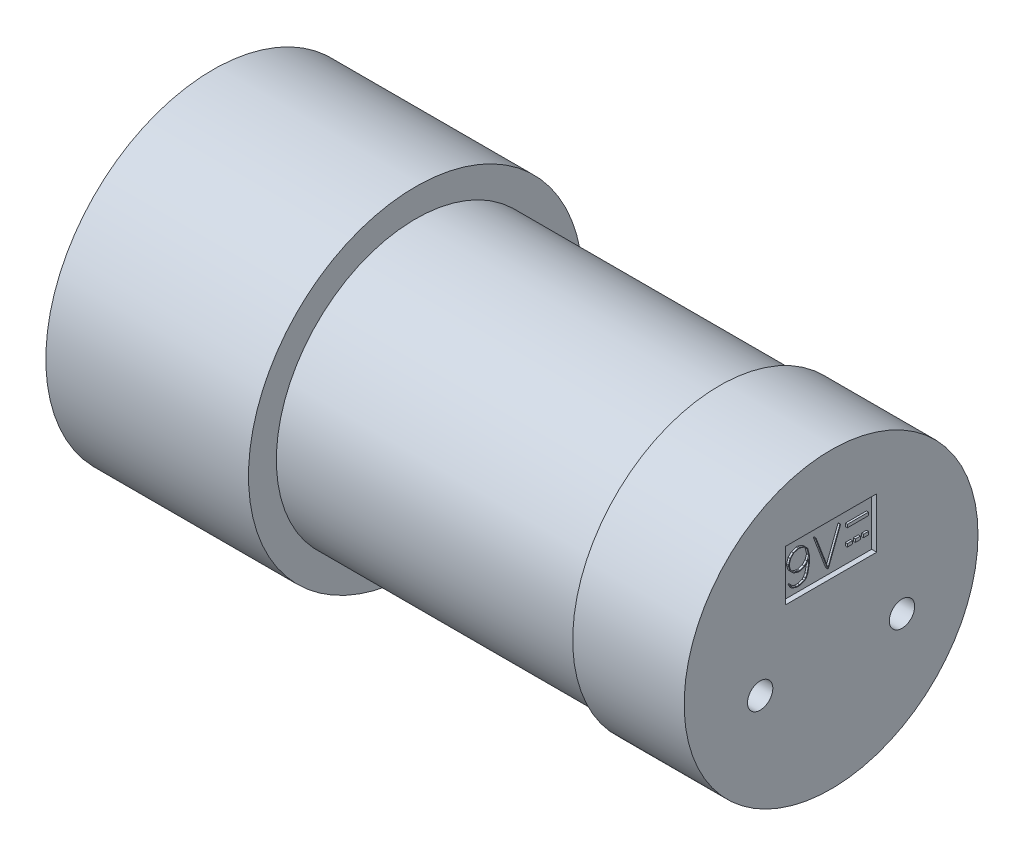
from build123d import *

# Parameters (mm, degrees)
SKETCH_1_R                   = 16.5
EXTRUDE_1_DEPTH              = 20
SKETCH_2_R                   = 13.75
EXTRUDE_2_DEPTH              = 30
SKETCH_3_R                   = 14.5
EXTRUDE_3_DEPTH              = 11
SKETCH_4_W                   = 9
SKETCH_4_H                   = 5
CUT_EXTRUDE_1_DEPTH          = 0.5
WRAP_1_OUTLINE_W             = 2.1
WRAP_1_OUTLINE_H             = 0.3
WRAP_1_OUTLINE_W_2           = 0.5
WRAP_1_DEPTH                 = 0.2
SKETCH_6_R                   = 1.25
CUT_EXTRUDE_2_DEPTH          = 6
CUT_EXTRUDE_3_DEPTH          = 0.5
SKETCH_8_R                   = 5
EXTRUDE_4_DEPTH              = 2.5
SKETCH_9_R                   = 3
CUT_EXTRUDE_4_DEPTH          = 2
SKETCH_10_R                  = 2.5
EXTRUDE_5_DEPTH              = 11.5
CUT_EXTRUDE_START            = -7
CUT_EXTRUDE_5_DEPTH          = 7
HOLE_WIZARD_M3_1_D           = 2.5
HOLE_WIZARD_M3_1_DEPTH       = 10
HOLE_WIZARD_M3_1_CSINK_D     = 3.4
HOLE_WIZARD_M3_1_CSINK_ANGLE = 45
HOLE_WIZARD_M3_1_TIP         = 0.751075774


# Read off the part's stored shape, not the designer's step: 包覆1
with BuildPart() as part:
    # 草图1 → 凸台-拉伸1 (new body)
    with BuildSketch(Plane(origin=(0, 0, 0), x_dir=(0, 0, -1), z_dir=(1, 0, 0))):
        Circle(SKETCH_1_R)
    extrude(amount=EXTRUDE_1_DEPTH)

    # 草图2 → 凸台-拉伸2 (add)
    with BuildSketch(Plane(origin=(20, 0, 0), x_dir=(0, 0, -1), z_dir=(1, 0, 0))):
        Circle(SKETCH_2_R)
    extrude(amount=EXTRUDE_2_DEPTH)

    # 草图3 → 凸台-拉伸3 (add)
    with BuildSketch(Plane(origin=(50, 0, 0), x_dir=(0, 0, -1), z_dir=(1, 0, 0))):
        Circle(SKETCH_3_R)
    extrude(amount=EXTRUDE_3_DEPTH)

    # 草图4 → 切除-拉伸1 (cut)
    with BuildSketch(Plane(origin=(61, 0, 0), x_dir=(0, 0, -1), z_dir=(1, 0, 0))):
        with Locations((0, 6)):
            Rectangle(SKETCH_4_W, SKETCH_4_H)
    extrude(amount=-CUT_EXTRUDE_1_DEPTH, mode=Mode.SUBTRACT)

    # 包覆1 outline → 包覆1 (add)
    # profile 1 of 6: a face of its own
    with BuildSketch(Plane(origin=(60.5, 0, 0), x_dir=(0, 0, -1), z_dir=(1, 0, 0))):
        Polygon((-2.789418513, 5.369902097), (-2.320955301, 5.52689379), (-2.003204114, 5.844644976), (-1.916544699, 6.105251187), (-1.916544699, 5.562687896), (-2.069140625, 4.810383703), (-2.217340783, 4.515867286), (-2.354865506, 4.371434929), (-2.798210047, 4.225746638), (-3.092726464, 4.225746638), (-3.52727947, 4.371434929), (-3.675479628, 4.664067445), (-3.737020372, 4.628273339), (-3.580028679, 4.312406052), (-3.103401899, 4.159810127), (-2.789418513, 4.159810127), (-2.320955301, 4.312406052), (-2.15580004, 4.473793513), (-1.998808347, 4.785265032), (-1.848724288, 5.55201246), (-1.848724288, 6.321899723), (-2.003204114, 6.942330894), (-2.320955301, 7.25819818), (-2.789418513, 7.415189873), (-2.950805973, 7.415189873), (-3.419269185, 7.25819818), (-3.737020372, 6.942330894), (-3.891500198, 6.473867682), (-3.891500198, 6.313108188), (-3.737020372, 5.844644976), (-3.419269185, 5.52689379), (-2.950805973, 5.369902097), align=None)
        Polygon((-2.798210047, 7.35553303), (-2.354865506, 7.209844739), (-2.064744858, 6.917212223), (-1.916544699, 6.328179391), (-2.064744858, 5.889230617), (-2.354865506, 5.599109968), (-2.798210047, 5.450281843), (-2.942014438, 5.450281843), (-3.385358979, 5.599109968), (-3.675479628, 5.889230617), (-3.823679786, 6.331947191), (-3.823679786, 6.476379549), (-3.675479628, 6.917212223), (-3.385358979, 7.209844739), (-2.942014438, 7.35553303), align=None, mode=Mode.SUBTRACT)
    # profile 2 of 6: a face of its own
    with BuildSketch(Plane(origin=(60.5, 0, 0), x_dir=(0, 0, -1), z_dir=(1, 0, 0))):
        Polygon((-1.248388054, 7.389443236), (-0.038296084, 4.2), (0.033920095, 4.2), (1.241500198, 7.375), (1.182471321, 7.400118671), (-0.002501978, 4.295450949), (-1.189359177, 7.415189873), align=None)
    # profile 3 of 6: a face of its own
    with BuildSketch(Plane(origin=(60.5, 0, 0), x_dir=(0, 0, -1), z_dir=(1, 0, 0))):
        with Locations((2.95, 6.883089037)):
            Rectangle(WRAP_1_OUTLINE_W, WRAP_1_OUTLINE_H)
    # profile 4 of 6: a face of its own
    with BuildSketch(Plane(origin=(60.5, 0, 0), x_dir=(0, 0, -1), z_dir=(1, 0, 0))):
        with Locations((3.75, 5.236905413)):
            Rectangle(WRAP_1_OUTLINE_W_2, WRAP_1_OUTLINE_H)
    # profile 5 of 6: a face of its own
    with BuildSketch(Plane(origin=(60.5, 0, 0), x_dir=(0, 0, -1), z_dir=(1, 0, 0))):
        with Locations((2.15, 5.236905413)):
            Rectangle(WRAP_1_OUTLINE_W_2, WRAP_1_OUTLINE_H)
    # profile 6 of 6: a face of its own
    with BuildSketch(Plane(origin=(60.5, 0, 0), x_dir=(0, 0, -1), z_dir=(1, 0, 0))):
        with Locations((2.95, 5.236905413)):
            Rectangle(WRAP_1_OUTLINE_W_2, WRAP_1_OUTLINE_H)
    extrude(amount=WRAP_1_DEPTH)

    # 草图6 → 切除-拉伸2 (cut)
    with BuildSketch(Plane(origin=(61, 0, 0), x_dir=(0, 0, -1), z_dir=(1, 0, 0))):
        with Locations((-7, -3)):
            Circle(SKETCH_6_R)
        with Locations(Location((7, -3, 0), (0, 0, 180))):
            Circle(SKETCH_6_R)
    extrude(amount=-CUT_EXTRUDE_2_DEPTH, mode=Mode.SUBTRACT)

    # 草图7 → 切除-拉伸3 (cut)
    with BuildSketch(Plane.ZY):
        with BuildLine():
            ThreePointArc((6.32455532, -9), (0, 11), (-6.32455532, -9))
            ThreePointArc((-6.32455532, -9), (0, 1), (6.32455532, -9))
        make_face()
    extrude(amount=-CUT_EXTRUDE_3_DEPTH, mode=Mode.SUBTRACT)

    # 草图8 → 凸台-拉伸4 (add)
    with BuildSketch(Plane.ZY):
        with Locations(Location((0, -6, 0), (0, 0, 180))):
            Circle(SKETCH_8_R)
    extrude(amount=EXTRUDE_4_DEPTH)

    # 草图9 → 切除-拉伸4 (cut)
    with BuildSketch(Plane.ZY.offset(2.5)):
        with Locations((0, -6)):
            Circle(SKETCH_9_R)
    extrude(amount=-CUT_EXTRUDE_4_DEPTH, mode=Mode.SUBTRACT)

    # 草图10 → 凸台-拉伸5 (add)
    with BuildSketch(Plane.ZY.offset(0.5)):
        with Locations((0, -6)):
            Circle(SKETCH_10_R)
    extrude(amount=EXTRUDE_5_DEPTH)

    # 草图11 → 切除-拉伸5 (cut)
    with BuildSketch(Plane.ZY.offset(12).offset(CUT_EXTRUDE_START)):
        with BuildLine():
            Line((0, -4.5), (-2, -4.5))
            ThreePointArc((-2, -4.5), (0, -3.5), (2, -4.5))
            Line((2, -4.5), (0, -4.5))
        make_face()
    extrude(amount=CUT_EXTRUDE_5_DEPTH, mode=Mode.SUBTRACT)

    # M3 螺纹孔1
    with Locations(Plane(origin=(0, 13.4, 0), x_dir=(0, 0, -1), z_dir=(-1, 0, 0))):
        with Locations((0, 0)):
            CounterSinkHole(HOLE_WIZARD_M3_1_D / 2, HOLE_WIZARD_M3_1_CSINK_D / 2, depth=HOLE_WIZARD_M3_1_DEPTH, counter_sink_angle=HOLE_WIZARD_M3_1_CSINK_ANGLE)
            with Locations((0, 0, -(HOLE_WIZARD_M3_1_DEPTH + HOLE_WIZARD_M3_1_TIP / 2))):  # 118° drill point
                Cone(0, HOLE_WIZARD_M3_1_D / 2, HOLE_WIZARD_M3_1_TIP, mode=Mode.SUBTRACT)


solid = part.part
